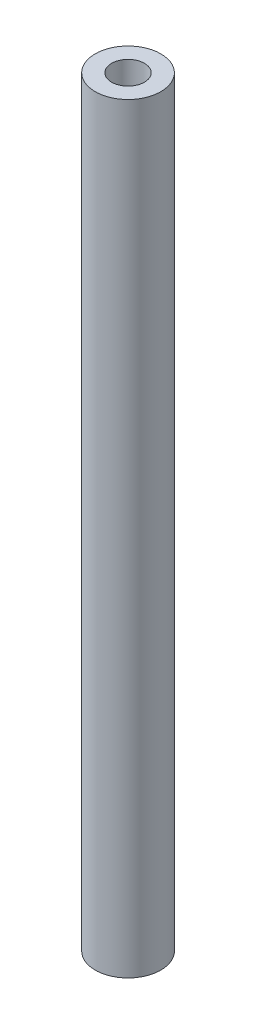
from build123d import *

# Parameters (mm, degrees)
SKETCH1_R           = 5
BOSS_EXTRUDE1_DEPTH = 116
SKETCH2_R           = 2.5
CUT_EXTRUDE1_DEPTH  = 10
CUT_EXTRUDE2_START  = -10
SKETCH3_R           = 2.5
CUT_EXTRUDE2_DEPTH  = 10


with BuildPart() as part:
    # Sketch1 → Boss-Extrude1 (new body)
    with BuildSketch(Plane(origin=(0, 0, 0), x_dir=(1, 0, 0), z_dir=(0, 1, 0))):
        Circle(SKETCH1_R)
    extrude(amount=BOSS_EXTRUDE1_DEPTH)

    # Sketch2 → Cut-Extrude1 (cut)
    with BuildSketch(Plane(origin=(0, 116, 0), x_dir=(1, 0, 0), z_dir=(0, 1, 0))):
        Circle(SKETCH2_R)
    extrude(amount=-CUT_EXTRUDE1_DEPTH, mode=Mode.SUBTRACT)

    # Sketch3 → Cut-Extrude2 (cut)
    with BuildSketch(Plane.XZ.offset(CUT_EXTRUDE2_START)):
        Circle(SKETCH3_R)
    extrude(amount=CUT_EXTRUDE2_DEPTH, mode=Mode.SUBTRACT)


solid = part.part
